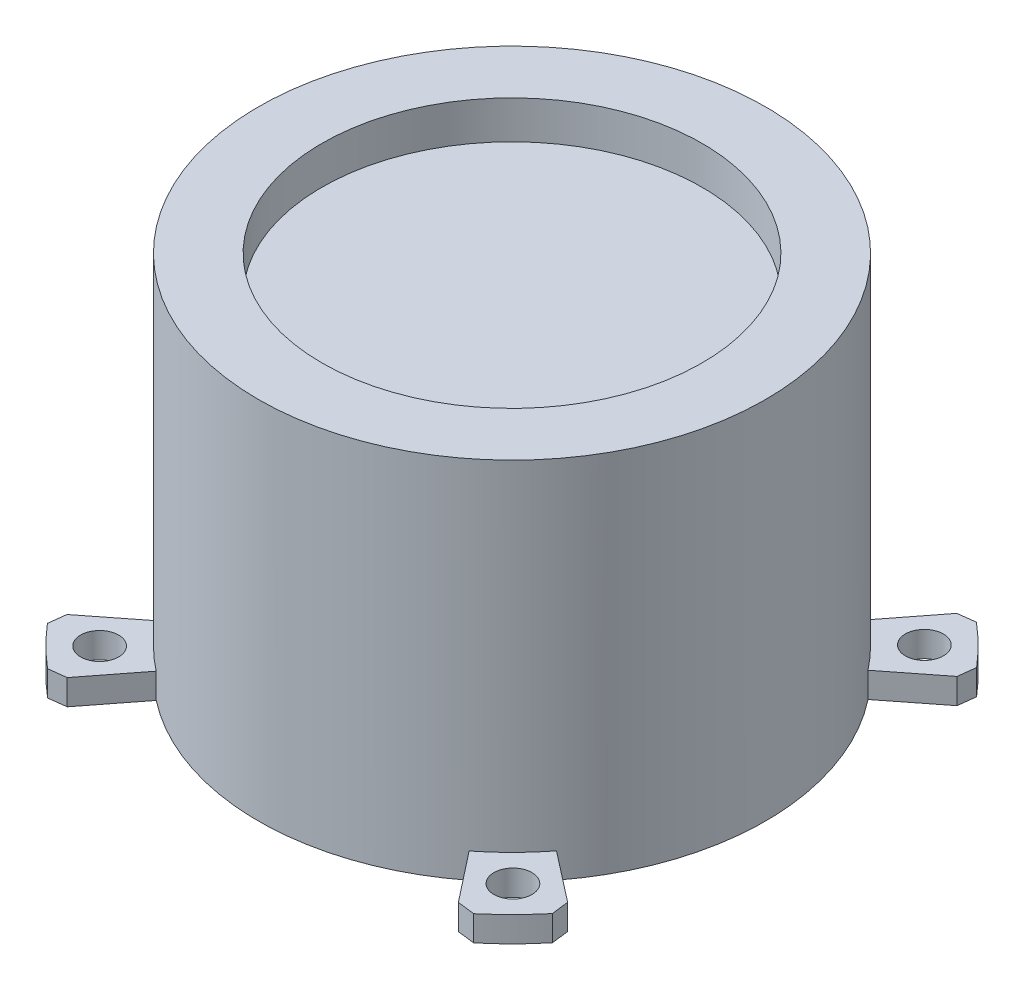
from build123d import *

# Parameters (mm, degrees)
SKETCH1_R           = 20
BOSS_EXTRUDE1_DEPTH = 25.8
SKETCH2_R           = 1.5
BOSS_EXTRUDE4_DEPTH = 2
CHAMFER1_SIZE       = 1
SKETCH3_R           = 20
SKETCH3_R_2         = 15
BOSS_EXTRUDE5_DEPTH = 3


with BuildPart() as part:
    # Sketch1 → Boss-Extrude1 (new body)
    with BuildSketch(Plane(origin=(0, 0, 0), x_dir=(1, 0, 0), z_dir=(0, 1, 0))):
        with Locations(Location((0, 0, 0), (0, 0, 90))):
            Circle(SKETCH1_R)
    extrude(amount=BOSS_EXTRUDE1_DEPTH)

    # Sketch2 → Boss-Extrude4 (add)
    # profile 1 of 4: a face of its own
    with BuildSketch(Plane(origin=(0, 0, 0), x_dir=(1, 0, 0), z_dir=(0, 1, 0))):
        with BuildLine():
            Line((-12.348666302, 15.732464542), (-16.053266193, 20.452203904))
            ThreePointArc((-16.053266193, 20.452203904), (-18.426104242, 18.343355267), (-20.524251517, 15.961049453))
            Line((-20.524251517, 15.961049453), (-15.787885783, 12.277730349))
            ThreePointArc((-15.787885783, 12.277730349), (-14.17392634, 14.110273282), (-12.348666302, 15.732464542))
        make_face()
        with Locations(Location((-16.300015291, 16.226814275, 0), (0, 0, 270))):
            Circle(SKETCH2_R, mode=Mode.SUBTRACT)
    # profile 2 of 4: a face of its own
    with BuildSketch(Plane(origin=(0, 0, 0), x_dir=(1, 0, 0), z_dir=(0, 1, 0))):
        with BuildLine():
            Line((15.732464542, 12.348666302), (20.452203904, 16.053266193))
            ThreePointArc((20.452203904, 16.053266193), (18.343355267, 18.426104242), (15.961049453, 20.524251517))
            Line((15.961049453, 20.524251517), (12.277730349, 15.787885783))
            ThreePointArc((12.277730349, 15.787885783), (14.110273282, 14.17392634), (15.732464542, 12.348666302))
        make_face()
        with Locations(Location((16.226814275, 16.300015291, 0), (0, 0, 270))):
            Circle(SKETCH2_R, mode=Mode.SUBTRACT)
    # profile 3 of 4: a face of its own
    with BuildSketch(Plane(origin=(0, 0, 0), x_dir=(1, 0, 0), z_dir=(0, 1, 0))):
        with BuildLine():
            Line((12.348666302, -15.732464542), (16.053266193, -20.452203904))
            ThreePointArc((16.053266193, -20.452203904), (18.426104242, -18.343355267), (20.524251517, -15.961049453))
            Line((20.524251517, -15.961049453), (15.787885783, -12.277730349))
            ThreePointArc((15.787885783, -12.277730349), (14.17392634, -14.110273282), (12.348666302, -15.732464542))
        make_face()
        with Locations(Location((16.300015291, -16.226814275, 0), (0, 0, 270))):
            Circle(SKETCH2_R, mode=Mode.SUBTRACT)
    # profile 4 of 4: a face of its own
    with BuildSketch(Plane(origin=(0, 0, 0), x_dir=(1, 0, 0), z_dir=(0, 1, 0))):
        with BuildLine():
            Line((-15.732464542, -12.348666302), (-20.452203904, -16.053266193))
            ThreePointArc((-20.452203904, -16.053266193), (-18.343355267, -18.426104242), (-15.961049453, -20.524251517))
            Line((-15.961049453, -20.524251517), (-12.277730349, -15.787885783))
            ThreePointArc((-12.277730349, -15.787885783), (-14.110273282, -14.17392634), (-15.732464542, -12.348666302))
        make_face()
        with Locations(Location((-16.226814275, -16.300015291, 0), (0, 0, 270))):
            Circle(SKETCH2_R, mode=Mode.SUBTRACT)
    extrude(amount=BOSS_EXTRUDE4_DEPTH)

    # Chamfer1
    # the kernel refuses this chamfer: 1 mm, written as the material it takes off along each edge
    with BuildSketch(Plane(origin=(-20.452203904, -2.571682988, 16.053266193), x_dir=(0.786623227084006, 0, -0.6174333151134171), z_dir=(0, 1, 0)), Plane(origin=(16.053266193, -2.571682988, 20.452203904), x_dir=(-0.6174333151134189, 0, -0.7866232270840047), z_dir=(0, 1, 0)), Plane(origin=(20.452203904, -2.571682988, -16.053266193), x_dir=(-0.7866232270840033, 0, 0.6174333151134205), z_dir=(0, 1, 0)), Plane(origin=(-16.053266193, -2.571682988, -20.452203904), x_dir=(0.6174333151134251, 0, 0.7866232270839999), z_dir=(0, 1, 0))) as chamfer1_piece_1:
        with BuildLine():
            Line((CHAMFER1_SIZE, 0), (0.018531237, -0.981468763))
            ThreePointArc((0.018531237, -0.981468763), (0.004898706, -0.504686734), (0, 0))
            Line((0, 0), (CHAMFER1_SIZE, 0))
        make_face()
    extrude(amount=7.143365976, mode=Mode.SUBTRACT)
    with BuildSketch(Plane(origin=(-15.961049453, -2.571682988, 20.524251517), x_dir=(0.6138865174304216, 0, -0.7893942891338579), z_dir=(0, 1, 0)), Plane(origin=(20.524251517, -2.571682988, 15.961049453), x_dir=(-0.7893942891338613, 0, -0.6138865174304171), z_dir=(0, 1, 0)), Plane(origin=(15.961049453, -2.571682988, -20.524251517), x_dir=(-0.6138865174304153, 0, 0.7893942891338627), z_dir=(0, 1, 0)), Plane(origin=(-20.524251517, -2.571682988, -15.961049453), x_dir=(0.7893942891338679, 0, 0.6138865174304086), z_dir=(0, 1, 0))) as chamfer1_piece_2:
        with BuildLine():
            Line((CHAMFER1_SIZE, 0), (0.018531237, 0.981468763))
            ThreePointArc((0.018531237, 0.981468763), (0.004898706, 0.504686734), (0, 0))
            Line((0, 0), (CHAMFER1_SIZE, 0))
        make_face()
    extrude(amount=7.143365976, mode=Mode.SUBTRACT)

    # Sketch3 → Boss-Extrude5 (add)
    with BuildSketch(Plane(origin=(0, 25.8, 0), x_dir=(1, 0, 0), z_dir=(0, 1, 0))):
        with Locations(Location((0, 0, 0), (0, 0, 52.128942853))):
            Circle(SKETCH3_R)
        with Locations(Location((0, 0, 0), (0, 0, 270))):
            Circle(SKETCH3_R_2, mode=Mode.SUBTRACT)
    extrude(amount=BOSS_EXTRUDE5_DEPTH)


solid = part.part
